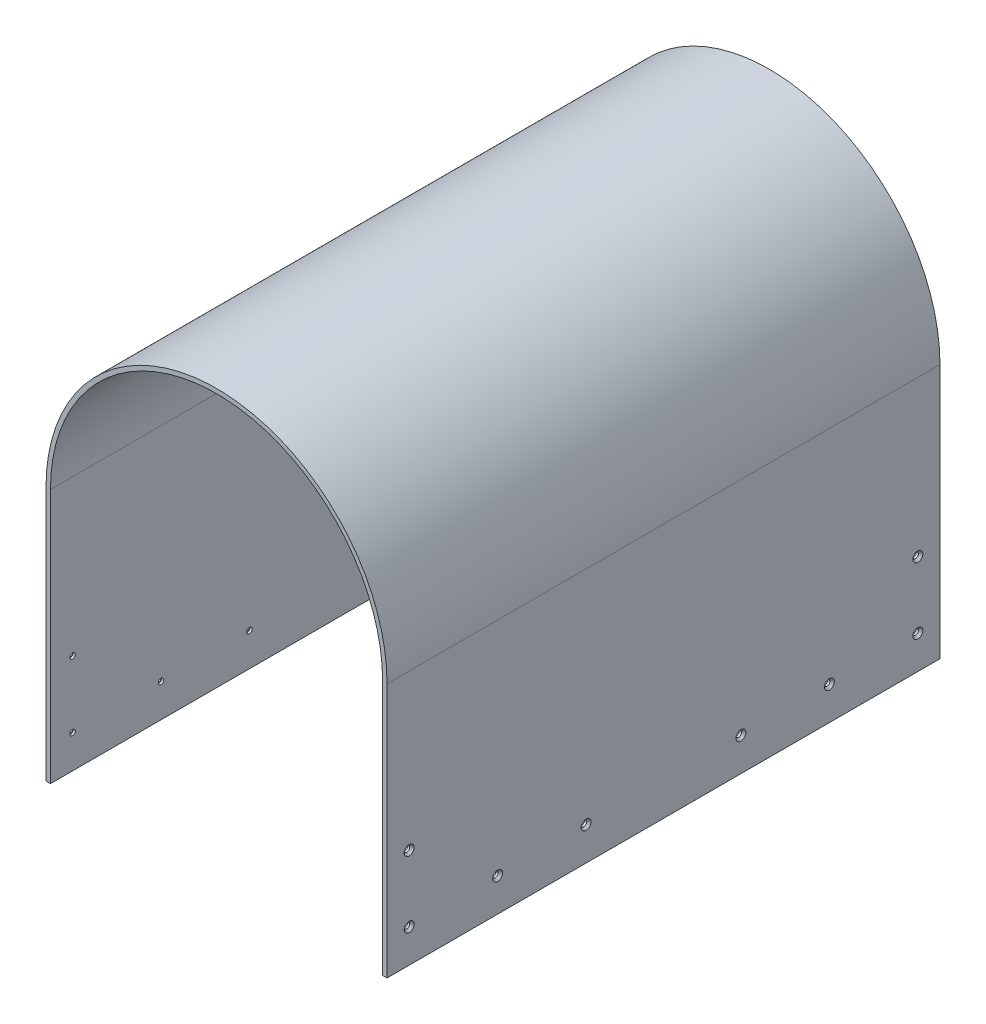
from build123d import *

# Parameters (mm, degrees)
BOSS_EXTRUDE1_DEPTH = 125
SKETCH3_R           = 1.25
CUT_EXTRUDE1_DEPTH  = 277.372809806
CHAMFER1_SIZE       = 1
CHAMFER2_SIZE       = 1
CUT_EXTRUDE2_REACH  = 278.373
SKETCH4_W           = 18
SKETCH4_H           = 14


with BuildPart() as part:
    # Sketch1 → Boss-Extrude1 (new, symmetric)
    with BuildSketch(Plane.XY):
        with BuildLine():
            Line((-75.1, 0), (-75.1, 115.2))
            ThreePointArc((-75.1, 115.2), (0, 190.3), (75.1, 115.2))
            Line((75.1, 115.2), (75.1, 0))
            Line((75.1, 0), (77.1, 0))
            Line((77.1, 0), (77.1, 115.2))
            ThreePointArc((77.1, 115.2), (0, 192.3), (-77.1, 115.2))
            Line((-77.1, 115.2), (-77.1, 0))
            Line((-77.1, 0), (-75.1, 0))
        make_face()
    extrude(amount=BOSS_EXTRUDE1_DEPTH, both=True)

    # Sketch3 → Cut-Extrude1 (cut, through all)
    with BuildSketch(Plane.ZY.offset(77.1)):
        with Locations((-115, 15)):
            Circle(SKETCH3_R)
        with Locations((-75, 15)):
            Circle(SKETCH3_R)
        with Locations((-35, 15)):
            Circle(SKETCH3_R)
        with Locations((-115, 45)):
            Circle(SKETCH3_R)
    cut_extrude1 = extrude(amount=-CUT_EXTRUDE1_DEPTH, mode=Mode.SUBTRACT)

    # Mirror1: Cut-Extrude1 across plane
    add(cut_extrude1.mirror(Plane.XY), mode=Mode.SUBTRACT)

    # Chamfer1
    chamfer1_edges = [part.edges().sort_by_distance(p)[0] for p in [
        (-77.1, 15, 116.25),
        (-77.1, 45, 116.25),
        (-77.1, 15, 76.25),
        (-77.1, 15, 36.25),
        (-77.1, 15, -36.25),
        (-77.1, 15, -76.25),
        (-77.1, 15, -116.25),
        (-77.1, 45, -116.25),
    ]]
    chamfer(chamfer1_edges, length=CHAMFER1_SIZE)

    # Chamfer2
    chamfer2_edges = [part.edges().sort_by_distance(p)[0] for p in [
        (77.1, 45, -116.25),
        (77.1, 15, -116.25),
        (77.1, 15, -76.25),
        (77.1, 15, -36.25),
        (77.1, 15, 36.25),
        (77.1, 15, 76.25),
        (77.1, 15, 116.25),
        (77.1, 45, 116.25),
    ]]
    chamfer(chamfer2_edges, length=CHAMFER2_SIZE)

    # Sketch4 → Cut-Extrude2 (cut, up to next)
    with BuildSketch(Plane.ZY.offset(77.1), mode=Mode.PRIVATE) as cut_extrude2_sk1:
        with Locations((-20, 77)):
            Rectangle(SKETCH4_W, SKETCH4_H)
    cut_extrude2_tool1 = extrude(cut_extrude2_sk1.sketch, amount=-CUT_EXTRUDE2_REACH, mode=Mode.PRIVATE) & part.part
    add(cut_extrude2_tool1.solids().sort_by_distance((-77.1, 77, -20))[0], mode=Mode.SUBTRACT)


solid = part.part
